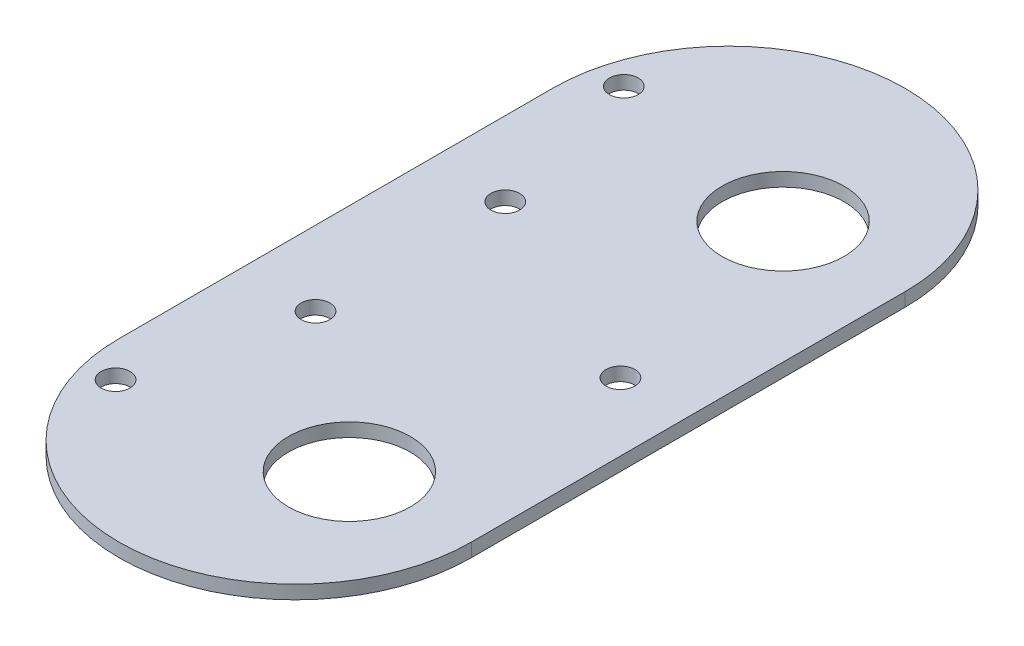
from build123d import *

# Parameters (mm, degrees)
SKETCH1_R                   = 14.2875
BOSS_EXTRUDE1_DEPTH         = 3.175
F_1_4_CLEARANCE_HOLE1_D     = 6.7564
F_1_4_CLEARANCE_HOLE1_DEPTH = 3.175
F_1_4_CLEARANCE_HOLE1_TIP   = 2.029827343


with BuildPart() as part:
    # Sketch1 → Boss-Extrude1 (new body)
    with BuildSketch(Plane(origin=(0, 0, 0), x_dir=(1, 0, 0), z_dir=(0, 1, 0))):
        with BuildLine():
            Line((-53.970534123, 50.8), (-53.970534123, -50.8))
            ThreePointArc((-53.970534123, -50.8), (-12.7, -92.070534123), (28.570534123, -50.8))
            Line((28.570534123, -50.8), (28.570534123, 50.8))
            ThreePointArc((28.570534123, 50.8), (-12.7, 92.070534123), (-53.970534123, 50.8))
        make_face()
        with Locations((0, 50.8)):
            Circle(SKETCH1_R, mode=Mode.SUBTRACT)
        with Locations((0, -50.8)):
            Circle(SKETCH1_R, mode=Mode.SUBTRACT)
    extrude(amount=BOSS_EXTRUDE1_DEPTH)

    # 1/4 Clearance Hole1
    with Locations(Plane(origin=(0, 3.175, 0), x_dir=(1, 0, 0), z_dir=(0, 1, 0))):
        with Locations((12.7, 0), (-46.0375, 59.53125), (-46.0375, -59.53125), (-36.5125, 22.225), (-36.5125, -22.225)):
            Hole(F_1_4_CLEARANCE_HOLE1_D / 2, depth=F_1_4_CLEARANCE_HOLE1_DEPTH)
            with Locations((0, 0, -(F_1_4_CLEARANCE_HOLE1_DEPTH + F_1_4_CLEARANCE_HOLE1_TIP / 2))):  # 118° drill point
                Cone(0, F_1_4_CLEARANCE_HOLE1_D / 2, F_1_4_CLEARANCE_HOLE1_TIP, mode=Mode.SUBTRACT)


solid = part.part
